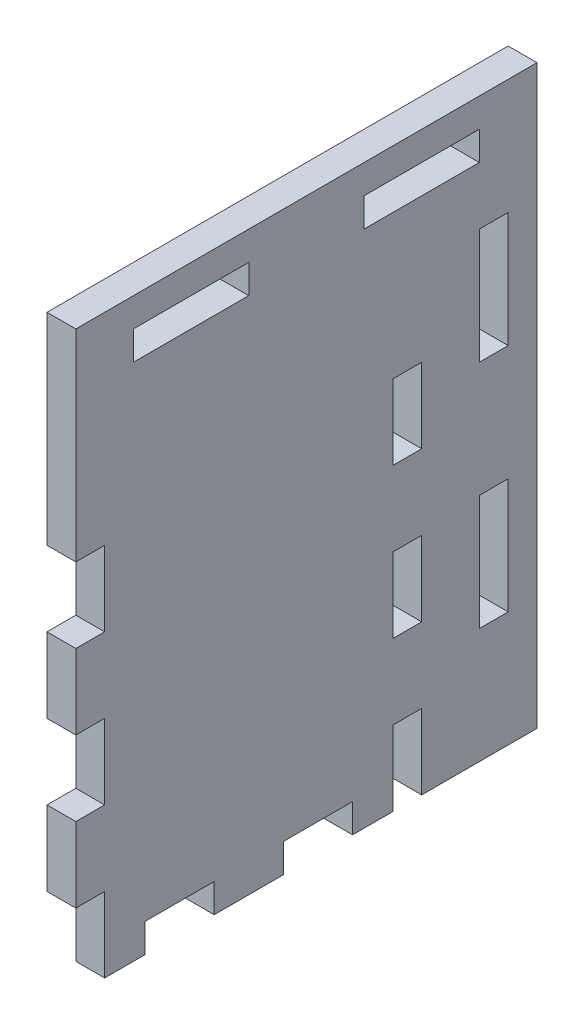
from build123d import *

# Parameters (mm, degrees)
BOSS_EXTRU_1_DEPTH         = 5
ESQUISSE2_W                = 12
ESQUISSE2_H                = 5
ENL_V_MAT_EXTRU_1_DEPTH    = 5
R_P_TITION_LIN_AIRE1_COUNT = 2
R_P_TITION_LIN_AIRE1_PITCH = 24
ESQUISSE4_W                = 5
ESQUISSE4_H                = 13
ENL_V_MAT_EXTRU_2_DEPTH    = 5
R_P_TITION_LIN_AIRE2_COUNT = 3
R_P_TITION_LIN_AIRE2_PITCH = 26
SYM_TRIE1_COPY_1_SKETCH_W  = 5
SYM_TRIE1_COPY_1_SKETCH_H  = 13
SYM_TRIE1_COPY_1_DEPTH     = 5
SYM_TRIE1_COPY_2_SKETCH_W  = 5
SYM_TRIE1_COPY_2_SKETCH_H  = 13
SYM_TRIE1_COPY_2_DEPTH     = 5
SYM_TRIE1_COPY_3_SKETCH_W  = 5
SYM_TRIE1_COPY_3_SKETCH_H  = 13
SYM_TRIE1_COPY_3_DEPTH     = 5
BOSS_EXTRU_3_DEPTH         = 5
ESQUISSE7_W                = 20
ESQUISSE7_H                = 5
ENL_V_MAT_EXTRU_3_DEPTH    = 5
ESQUISSE8_W                = 5
ESQUISSE8_H                = 20
ENL_V_MAT_EXTRU_4_DEPTH    = 5


with BuildPart() as part:
    # Esquisse1 → Boss.-Extru.1 (new body)
    with BuildSketch(Plane(origin=(0, 0, 0), x_dir=(0, 0, -1), z_dir=(1, 0, 0))):
        Polygon((0, 0), (0, 35), (45, 35), (45, 0), (60, 0), (60, -65), (0, -65), align=None)
    extrude(amount=BOSS_EXTRU_1_DEPTH)

    # Esquisse2 → Enlèv. mat.-Extru.1 (cut)
    with BuildSketch(Plane(origin=(5, 0, 0), x_dir=(0, 0, -1), z_dir=(1, 0, 0))):
        with Locations((18, -62.5)):
            Rectangle(ESQUISSE2_W, ESQUISSE2_H)
    enl_v_mat_extru_1 = extrude(amount=-ENL_V_MAT_EXTRU_1_DEPTH, mode=Mode.SUBTRACT)

    # Répétition linéaire1: Enlèv. mat.-Extru.1 ×2
    with Locations(*[(0, 0, -i * R_P_TITION_LIN_AIRE1_PITCH) for i in range(1, R_P_TITION_LIN_AIRE1_COUNT)]):
        add(enl_v_mat_extru_1, mode=Mode.SUBTRACT)

    # Esquisse4 → Enlèv. mat.-Extru.2 (cut)
    with BuildSketch(Plane(origin=(5, 0, 0), x_dir=(0, 0, -1), z_dir=(1, 0, 0))):
        with Locations((2.5, -58.5)):
            Rectangle(ESQUISSE4_W, ESQUISSE4_H)
    enl_v_mat_extru_2 = extrude(amount=-ENL_V_MAT_EXTRU_2_DEPTH, mode=Mode.SUBTRACT)

    # Répétition linéaire2: Enlèv. mat.-Extru.2 ×3
    with Locations(*[(0, i * R_P_TITION_LIN_AIRE2_PITCH, 0) for i in range(1, R_P_TITION_LIN_AIRE2_COUNT)]):
        add(enl_v_mat_extru_2, mode=Mode.SUBTRACT)

    # Symétrie1 copy 1 sketch → Symétrie1 copy 1 (cut)
    with BuildSketch(Plane(origin=(5, 26, -60), x_dir=(0, 0, 1), z_dir=(1, 0, 0))):
        with Locations((2.5, 58.5)):
            Rectangle(SYM_TRIE1_COPY_1_SKETCH_W, SYM_TRIE1_COPY_1_SKETCH_H)
    extrude(amount=-SYM_TRIE1_COPY_1_DEPTH, mode=Mode.SUBTRACT)

    # Symétrie1 copy 2 sketch → Symétrie1 copy 2 (cut)
    with BuildSketch(Plane(origin=(5, 52, -60), x_dir=(0, 0, 1), z_dir=(1, 0, 0))):
        with Locations((2.5, 58.5)):
            Rectangle(SYM_TRIE1_COPY_2_SKETCH_W, SYM_TRIE1_COPY_2_SKETCH_H)
    extrude(amount=-SYM_TRIE1_COPY_2_DEPTH, mode=Mode.SUBTRACT)

    # Symétrie1 copy 3 sketch → Symétrie1 copy 3 (cut)
    with BuildSketch(Plane(origin=(5, 0, -60), x_dir=(0, 0, 1), z_dir=(1, 0, 0))):
        with Locations((2.5, 58.5)):
            Rectangle(SYM_TRIE1_COPY_3_SKETCH_W, SYM_TRIE1_COPY_3_SKETCH_H)
    extrude(amount=-SYM_TRIE1_COPY_3_DEPTH, mode=Mode.SUBTRACT)

    # Esquisse5 → Boss.-Extru.3 (add)
    with BuildSketch(Plane(origin=(5, 0, 0), x_dir=(0, 0, -1), z_dir=(1, 0, 0))):
        Polygon((45, 0), (60, 0), (60, -65), (80, -65), (80, 35), (45, 35), align=None)
    extrude(amount=-BOSS_EXTRU_3_DEPTH)

    # Esquisse7 → Enlèv. mat.-Extru.3 (cut)
    with BuildSketch(Plane(origin=(5, 0, 0), x_dir=(0, 0, -1), z_dir=(1, 0, 0))):
        with Locations((20, 27.5)):
            Rectangle(ESQUISSE7_W, ESQUISSE7_H)
        with Locations((60, 27.5)):
            Rectangle(ESQUISSE7_W, ESQUISSE7_H)
    extrude(amount=-ENL_V_MAT_EXTRU_3_DEPTH, mode=Mode.SUBTRACT)

    # Esquisse8 → Enlèv. mat.-Extru.4 (cut)
    with BuildSketch(Plane(origin=(5, 0, 0), x_dir=(0, 0, -1), z_dir=(1, 0, 0))):
        with Locations((72.5, 5)):
            Rectangle(ESQUISSE8_W, ESQUISSE8_H)
        with Locations((72.5, -35)):
            Rectangle(ESQUISSE8_W, ESQUISSE8_H)
    extrude(amount=-ENL_V_MAT_EXTRU_4_DEPTH, mode=Mode.SUBTRACT)


solid = part.part
